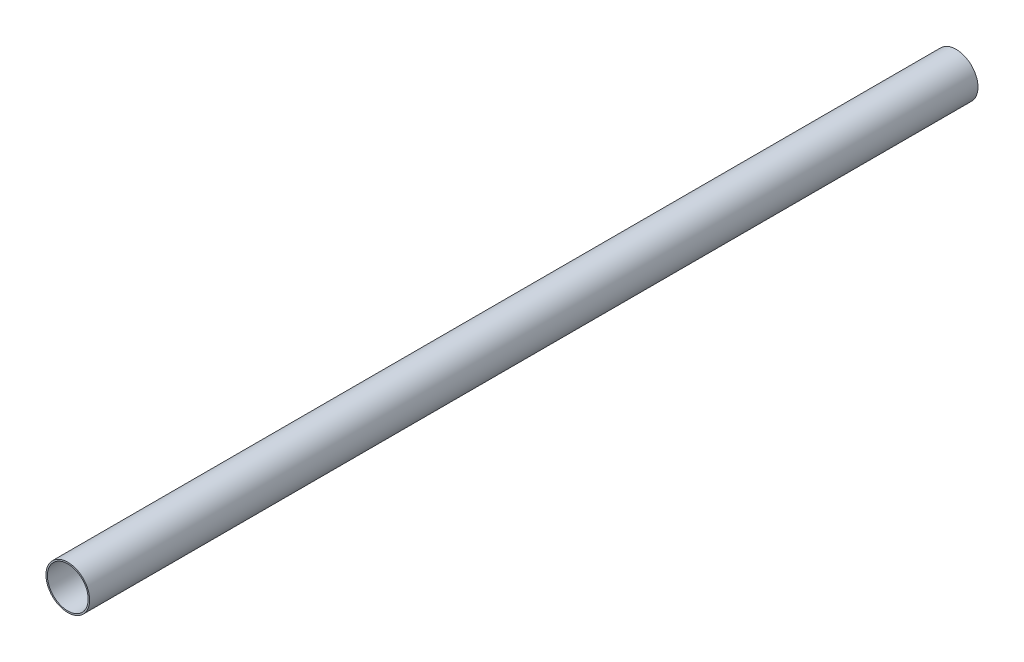
from build123d import *

# Parameters (mm, degrees)
SKETCH_1_R      = 15
SKETCH_1_R_2    = 14
EXTRUDE_1_DEPTH = 305


with BuildPart() as part:
    # Эскиз1 → Бобышка-Вытянуть1 (new, symmetric)
    with BuildSketch(Plane.XY):
        Circle(SKETCH_1_R)
        Circle(SKETCH_1_R_2, mode=Mode.SUBTRACT)
    extrude(amount=EXTRUDE_1_DEPTH, both=True)


solid = part.part
